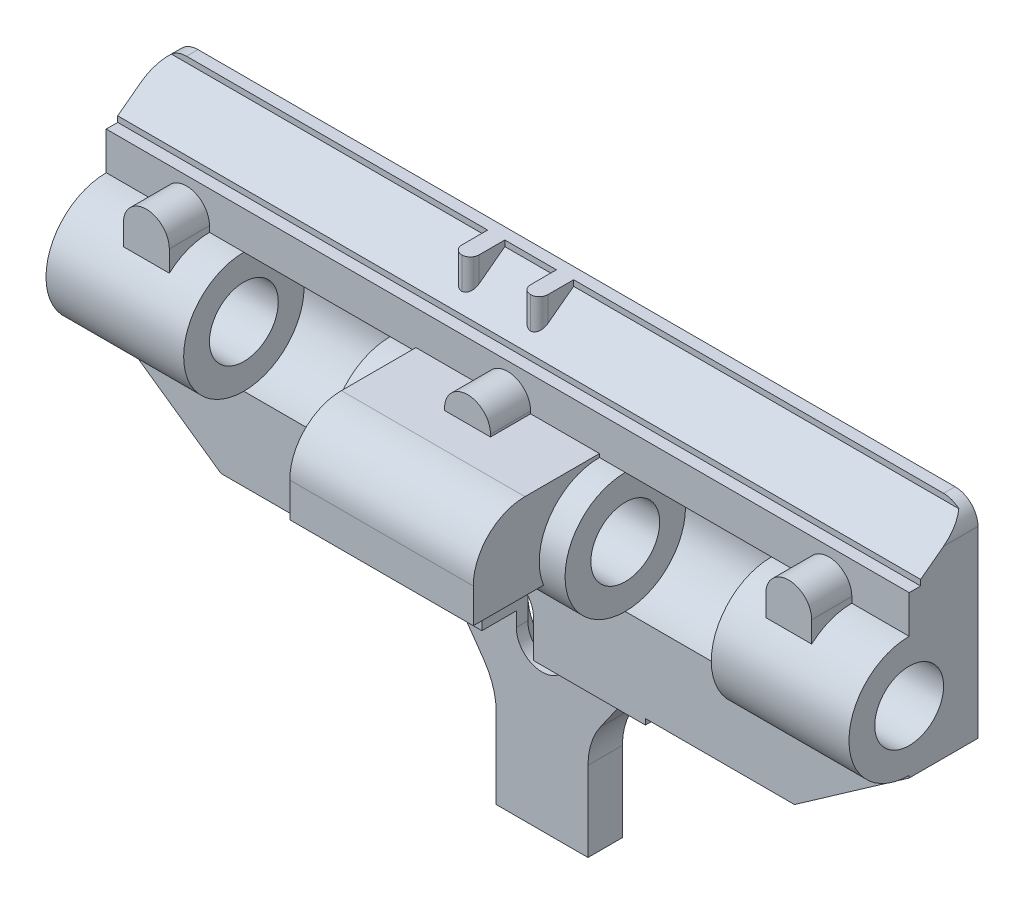
from build123d import *

# Parameters (mm, degrees)
BOSS_EXTRUDE1_DEPTH = 6
SKETCH2_R           = 5.25
CUT_EXTRUDE1_DEPTH  = 88
SKETCH2_2_R         = 5.25
BOSS_EXTRUDE2_DEPTH = 12
BOSS_EXTRUDE3_START = -24.75
SKETCH2_3_R         = 5.25
BOSS_EXTRUDE3_DEPTH = 10.25
SKETCH3_W           = 4
SKETCH3_H           = 8.859259966
BOSS_EXTRUDE4_DEPTH = 3
BOSS_EXTRUDE5_DEPTH = 3.5
CUT_EXTRUDE2_DEPTH  = 84.5
SKETCH14_W          = 24
SKETCH14_H          = 3
BOSS_EXTRUDE9_DEPTH = 0.5
BOSS_EXTRUDE7_DEPTH = 3.5
SKETCH12_W          = 11
SKETCH12_H          = 7.5
BOSS_EXTRUDE8_DEPTH = 8
SKETCH13_W          = 3
SKETCH13_H          = 5.5
CUT_EXTRUDE5_DEPTH  = 5.5
FILLET6_R           = 4.5
HOLE1_START         = -35
HOLE1_OUTLINE_R     = 3
HOLE1_DEPTH         = 70
CUT_EXTRUDE3_DEPTH  = 84.5
CHAMFER1_SIZE       = 2
FILLET3_R           = 2
BOSS_EXTRUDE6_REACH = 58.524
SKETCH9_W           = 1.5
SKETCH9_H           = 4
FILLET4_R           = 0.75
FILLET5_R           = 6


# Read off the part's stored shape, not the designer's step: Hole1
with BuildPart() as part:
    # Sketch1 → Boss-Extrude1 (new body)
    with BuildSketch(Plane.XY):
        Polygon((-25, 0), (25, 0), (35, 7.002075382), (35, 25), (-35, 25), (-35, 7.002075382), align=None)
    extrude(amount=BOSS_EXTRUDE1_DEPTH)

    # Sketch2 → Cut-Extrude1 (cut)
    with BuildSketch(Plane(origin=(35, 0, 0), x_dir=(0, 0, -1), z_dir=(1, 0, 0))):
        with Locations((-6, 12.452075382)):
            Circle(SKETCH2_R)
    extrude(amount=-CUT_EXTRUDE1_DEPTH, mode=Mode.SUBTRACT)

    # Sketch2<2> → Boss-Extrude2 (add)
    with BuildSketch(Plane(origin=(35, 0, 0), x_dir=(0, 0, -1), z_dir=(1, 0, 0))):
        with Locations((-6, 12.452075382)):
            Circle(SKETCH2_2_R)
    boss_extrude2 = extrude(amount=-BOSS_EXTRUDE2_DEPTH)

    # Sketch2<3> → Boss-Extrude3 (add)
    with BuildSketch(Plane(origin=(35, 0, 0), x_dir=(0, 0, -1), z_dir=(1, 0, 0)).offset(BOSS_EXTRUDE3_START)):
        with Locations((-6, 12.452075382)):
            Circle(SKETCH2_3_R)
    boss_extrude3 = extrude(amount=-BOSS_EXTRUDE3_DEPTH)

    # Sketch3 → Boss-Extrude4 (add)
    with BuildSketch(Plane(origin=(0, 0, 0), x_dir=(-1, 0, 0), z_dir=(0, 0, -1))):
        with Locations((2, -11.570370017)):
            Rectangle(SKETCH3_W, SKETCH3_H)
        Polygon((0, -7.140740034), (4, -7.140740034), (9, 0), (0, 0), align=None)
    boss_extrude4 = extrude(amount=-BOSS_EXTRUDE4_DEPTH)

    # Sketch4 → Boss-Extrude5 (add)
    with BuildSketch(Plane.XY.offset(6)):
        with BuildLine():
            Line((26, 10.749226565), (26, 18.202075382))
            ThreePointArc((26, 18.202075382), (28, 20.202075382), (30, 18.202075382))
            Line((30, 18.202075382), (30, 10.749226565))
            ThreePointArc((30, 10.749226565), (28, 8.749226565), (26, 10.749226565))
        make_face()
    boss_extrude5 = extrude(amount=BOSS_EXTRUDE5_DEPTH)

    # Sketch5 → Cut-Extrude2 (cut)
    with BuildSketch(Plane(origin=(35, 0, 0), x_dir=(0, 0, -1), z_dir=(1, 0, 0))):
        Polygon((-1, 25), (-1, 24.5), (-5, 21.5), (-5, 21), (-6, 21), (-6, 25), align=None)
    extrude(amount=-CUT_EXTRUDE2_DEPTH, mode=Mode.SUBTRACT)

    # Mirror2: Boss-Extrude2, Boss-Extrude3, Boss-Extrude4, Boss-Extrude5 across plane
    add(boss_extrude2.mirror(Plane(origin=(0, 0, 3), x_dir=(0, 0, 1), z_dir=(-1, 0, 0))))
    add(boss_extrude3.mirror(Plane(origin=(0, 0, 3), x_dir=(0, 0, 1), z_dir=(-1, 0, 0))))
    add(boss_extrude4.mirror(Plane(origin=(0, 0, 3), x_dir=(0, 0, 1), z_dir=(-1, 0, 0))))
    add(boss_extrude5.mirror(Plane(origin=(0, 0, 3), x_dir=(0, 0, 1), z_dir=(-1, 0, 0))))

    # Sketch14 → Boss-Extrude9 (add)
    with BuildSketch(Plane.XZ):
        with Locations((0, 4.5)):
            Rectangle(SKETCH14_W, SKETCH14_H)
    extrude(amount=BOSS_EXTRUDE9_DEPTH)

    # Sketch10 → Boss-Extrude7 (add)
    with BuildSketch(Plane.XY.offset(6)):
        with BuildLine():
            Line((-2, 12.452075382), (-2, 18.202075382))
            ThreePointArc((-2, 18.202075382), (0, 20.202075382), (2, 18.202075382))
            Line((2, 18.202075382), (2, 12.452075382))
            ThreePointArc((2, 12.452075382), (0, 10.452075382), (-2, 12.452075382))
        make_face()
    extrude(amount=BOSS_EXTRUDE7_DEPTH)

    # Sketch12 → Boss-Extrude8 (add, symmetric)
    with BuildSketch(Plane(origin=(0, 0, 0), x_dir=(0, 0, -1), z_dir=(1, 0, 0))):
        with Locations((-11.5, 14.25)):
            Rectangle(SKETCH12_W, SKETCH12_H)
    extrude(amount=BOSS_EXTRUDE8_DEPTH, both=True)

    # Sketch13 → Cut-Extrude5 (cut, symmetric)
    with BuildSketch(Plane(origin=(0, 0, 0), x_dir=(0, 0, -1), z_dir=(1, 0, 0))):
        with Locations((-13.5, 13.25)):
            Rectangle(SKETCH13_W, SKETCH13_H)
    extrude(amount=CUT_EXTRUDE5_DEPTH, both=True, mode=Mode.SUBTRACT)

    # Fillet6
    fillet6_edges = [part.edges().sort_by_distance(p)[0] for p in [
        (0, 18, 17),
    ]]
    fillet(fillet6_edges, radius=FILLET6_R)

    # Hole1 outline → Hole1 (cut)
    with BuildSketch(Plane.YZ.offset(HOLE1_START)):
        with Locations((12.452075382, 6)):
            Circle(HOLE1_OUTLINE_R)
    extrude(amount=HOLE1_DEPTH, mode=Mode.SUBTRACT)

    # Sketch7 → Cut-Extrude3 (cut)
    with BuildSketch(Plane.XY.offset(6)):
        with BuildLine():
            Line((-2.25, -1.75), (-2.25, 2.75))
            ThreePointArc((-2.25, 2.75), (0, 5), (2.25, 2.75))
            Line((2.25, 2.75), (2.25, -1.75))
            ThreePointArc((2.25, -1.75), (0, -4), (-2.25, -1.75))
        make_face()
    extrude(amount=-CUT_EXTRUDE3_DEPTH, mode=Mode.SUBTRACT)

    # Chamfer1
    chamfer1_edges = [part.edges().sort_by_distance(p)[0] for p in [
        (0, 5, 0),
        (0, -4, 0),
        (-2.25, 0.5, 0),
        (2.25, 0.5, 0),
    ]]
    chamfer(chamfer1_edges, length=CHAMFER1_SIZE)

    # Fillet3
    fillet3_edges = [part.edges().sort_by_distance(p)[0] for p in [
        (-35, 25, 0.5),
        (35, 25, 0.5),
    ]]
    fillet(fillet3_edges, radius=FILLET3_R)

    # Boss-Extrude6: up to this face of the body (flat: up to its plane)
    boss_extrude6_end = Plane(part.part.faces().sort_by_distance((0, 22.996608877, 3.004521497))[0])
    # Sketch9 → Boss-Extrude6 (add, up to the picked face)
    with BuildSketch(Plane(origin=(0, 25, 0), x_dir=(1, 0, 0), z_dir=(0, 1, 0)), mode=Mode.PRIVATE) as boss_extrude6_sk1:
        with Locations((0, -2)):
            Rectangle(SKETCH9_W, SKETCH9_H)
    boss_extrude6_tool1 = split(extrude(boss_extrude6_sk1.sketch, amount=-BOSS_EXTRUDE6_REACH, mode=Mode.PRIVATE), bisect_by=boss_extrude6_end, keep=Keep.BOTH, mode=Mode.PRIVATE)
    # Sketch9 → Boss-Extrude6 (add, up to the picked face)
    with BuildSketch(Plane(origin=(0, 25, 0), x_dir=(1, 0, 0), z_dir=(0, 1, 0)), mode=Mode.PRIVATE) as boss_extrude6_sk2:
        with Locations((-6, -2)):
            Rectangle(SKETCH9_W, SKETCH9_H)
    boss_extrude6_tool2 = split(extrude(boss_extrude6_sk2.sketch, amount=-BOSS_EXTRUDE6_REACH, mode=Mode.PRIVATE), bisect_by=boss_extrude6_end, keep=Keep.BOTH, mode=Mode.PRIVATE)
    add(boss_extrude6_tool1.solids().sort_by(Axis((0, 25, 2), (0, -1, 0)))[0])
    add(boss_extrude6_tool2.solids().sort_by(Axis((-6, 25, 2), (0, -1, 0)))[0])

    # Fillet4
    fillet4_edges = [part.edges().sort_by_distance(p)[0] for p in [
        (-6.75, 23.625, 4),
        (-5.25, 23.625, 4),
        (-0.75, 23.625, 4),
        (0.75, 23.625, 4),
    ]]
    fillet(fillet4_edges, radius=FILLET4_R - 0.0001)  # a hair under: the kernel refuses the full size

    # Fillet5
    fillet5_edges = [part.edges().sort_by_distance(p)[0] for p in [
        (4, -7.140740034, 1.5),
        (-4, -7.140740034, 1.5),
    ]]
    fillet(fillet5_edges, radius=FILLET5_R)


solid = part.part
